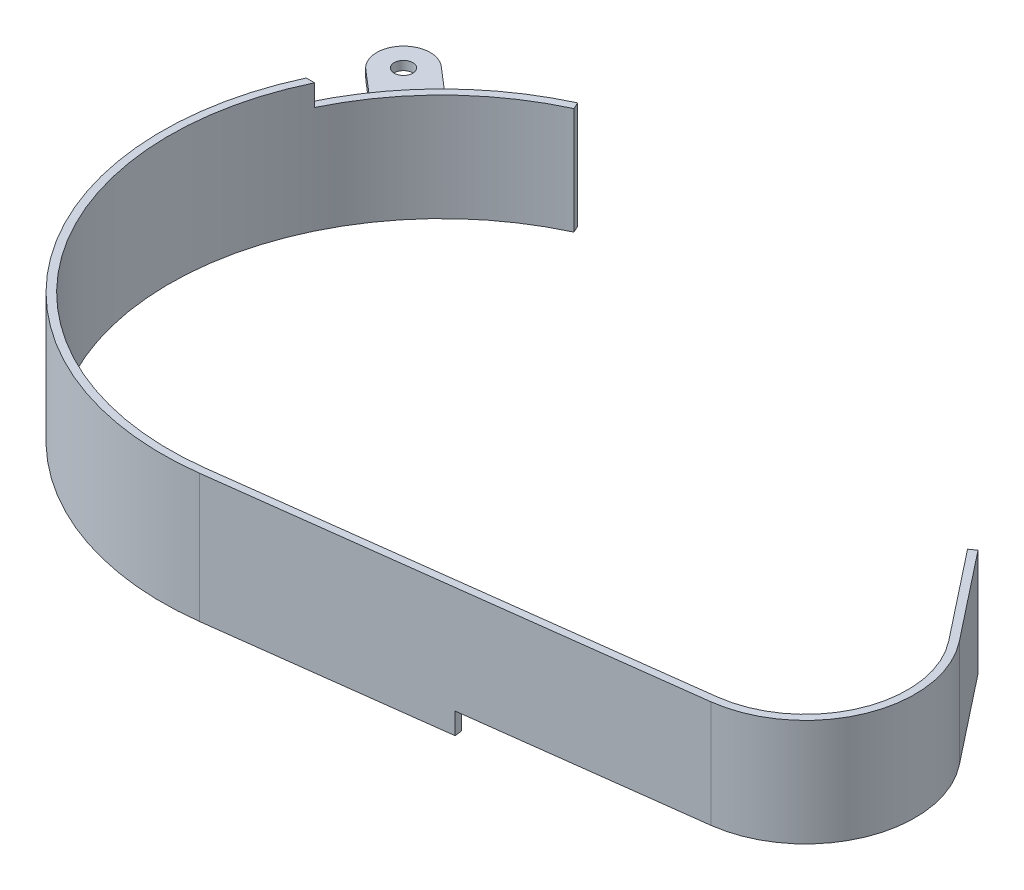
from build123d import *
from build123d.topology import SkipClean

# Parameters (mm, degrees)
BASE_FLANGE1_DEPTH  = 38.1
CUT_EXTRUDE1_DEPTH  = 7.62
SKETCH9_R           = 3.3
BOSS_EXTRUDE1_DEPTH = 3.175
BOSS_EXTRUDE2_DEPTH = 7.62


# Sheet-metal steps are written as plain solids
with BuildPart() as part:
    # Sketch1 → Base-Flange1 (new body)
    with BuildSketch(Plane(origin=(0, 0, 0), x_dir=(1, 0, 0), z_dir=(0, 1, 0))):
        with BuildLine():
            Line((-657.047015903, -180.398251424), (-495.540915967, -159.83264605))
            ThreePointArc((-495.540915967, -159.83264605), (-466.529161595, -137.56639807), (-471.621526187, -101.351269827))
            Line((-471.621526187, -101.351269827), (-496.558145126, -69.722999952))
            Line((-496.558145126, -69.722999952), (-494.363477067, -68.198999952))
            Line((-494.363477067, -68.198999952), (-469.527179345, -99.700027778))
            ThreePointArc((-469.527179345, -99.700027778), (-464.060656724, -138.576037958), (-495.204030033, -162.478283377))
            Line((-495.204030033, -162.478283377), (-656.710129969, -183.043888751))
            ThreePointArc((-656.710129969, -183.043888751), (-764.987734735, -111.822063922), (-711.2, 6.090902363))
            Line((-711.2, 6.090902363), (-710.077660148, 3.671554877))
            ThreePointArc((-710.077660148, 3.671554877), (-762.424972114, -111.083730158), (-657.047015903, -180.398251424))
        make_face()
    extrude(amount=-BASE_FLANGE1_DEPTH)

    # Sketch7 → Cut-Extrude1 (cut)
    with BuildSketch(Plane(origin=(-711.2, 0, -6.090902363), x_dir=(1, 0, 0), z_dir=(0, 1, 0))):
        with BuildLine():
            Line((1.122339852, -2.419347486), (0, 0))
            ThreePointArc((0, 0), (-28.443609249, -19.854342865), (-48.352212426, -48.26))
            Line((-48.352212426, -48.26), (-45.400744677, -48.26))
            ThreePointArc((-45.400744677, -48.26), (-26.116771828, -21.302890058), (1.122339852, -2.419347486))
        make_face()
    extrude(amount=-CUT_EXTRUDE1_DEPTH, mode=Mode.SUBTRACT)

    # Sketch9 → Boss-Extrude1 (add)
    with BuildSketch(Plane(origin=(0, -11.93175668, 0), x_dir=(1, 0, 0), z_dir=(0, 1, 0))):
        with BuildLine():
            ThreePointArc((-751.074016673, -2.593523568), (-764.50540437, -3.617766971), (-763.481160967, -17.049154667))
            Line((-763.481160967, -17.049154667), (-751.193944793, -27.595167013))
            ThreePointArc((-751.193944793, -27.595167013), (-745.401952839, -20.024035331), (-738.912633033, -13.041347154))
            Line((-738.912633033, -13.041347154), (-751.074016673, -2.593523568))
        make_face()
        with Locations(Location((-757.27758882, -9.821339117, 0), (0, 0, 270))):
            Circle(SKETCH9_R, mode=Mode.SUBTRACT)
    extrude(amount=-BOSS_EXTRUDE1_DEPTH)

    # Sketch10 → Boss-Extrude2 (add)
    with SkipClean():  # the faces are left unmerged after this step: merging them gives an invalid solid
        with BuildSketch(Plane.XZ.offset(38.1)):
            with BuildLine():
                Line((-710.077660148, -3.671554877), (-711.2, -6.090902363))
                ThreePointArc((-711.2, -6.090902363), (-764.987734735, 111.822063922), (-656.710129969, 183.043888751))
                Line((-656.710129969, 183.043888751), (-575.957080001, 172.761086064))
                Line((-575.957080001, 172.761086064), (-576.293965935, 170.115448737))
                Line((-576.293965935, 170.115448737), (-657.047015903, 180.398251424))
                ThreePointArc((-657.047015903, 180.398251424), (-762.424972114, 111.083730158), (-710.077660148, -3.671554877))
            make_face()
        extrude(amount=BOSS_EXTRUDE2_DEPTH)


solid = part.part
